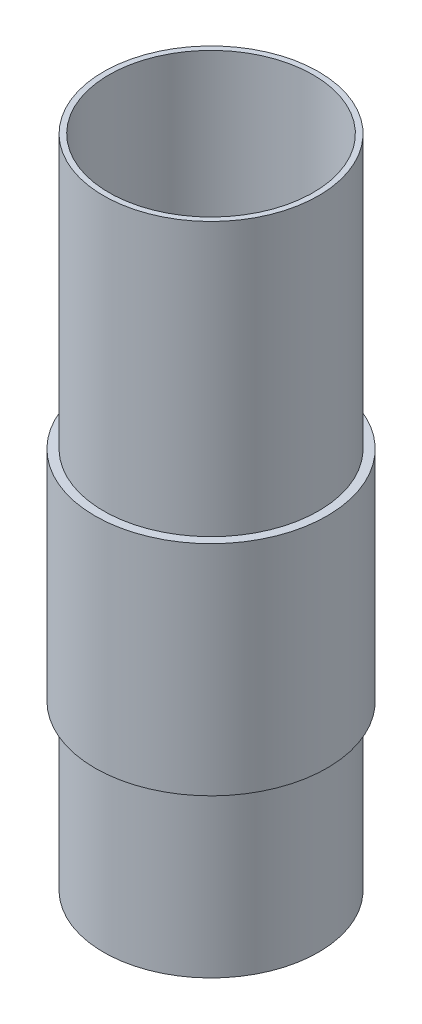
from build123d import *

# Parameters (mm, degrees)
SKETCH1_R           = 25.0063
SKETCH1_R_2         = 23.749
BOSS_EXTRUDE1_DEPTH = 152.4
BOSS_EXTRUDE3_START = -50.8
SKETCH5_R           = 27.0002
SKETCH5_R_2         = 25.0063
BOSS_EXTRUDE3_DEPTH = 50.8


with BuildPart() as part:
    # Sketch1 → Boss-Extrude1 (new body)
    with BuildSketch(Plane(origin=(0, 0, 0), x_dir=(1, 0, 0), z_dir=(0, 1, 0))):
        Circle(SKETCH1_R)
        Circle(SKETCH1_R_2, mode=Mode.SUBTRACT)
    extrude(amount=BOSS_EXTRUDE1_DEPTH)

    # Sketch5 → Boss-Extrude3 (add)
    with BuildSketch(Plane(origin=(0, 88.9, 0), x_dir=(1, 0, 0), z_dir=(0, 1, 0)).offset(BOSS_EXTRUDE3_START)):
        Circle(SKETCH5_R)
        Circle(SKETCH5_R_2, mode=Mode.SUBTRACT)
    extrude(amount=BOSS_EXTRUDE3_DEPTH)


solid = part.part
